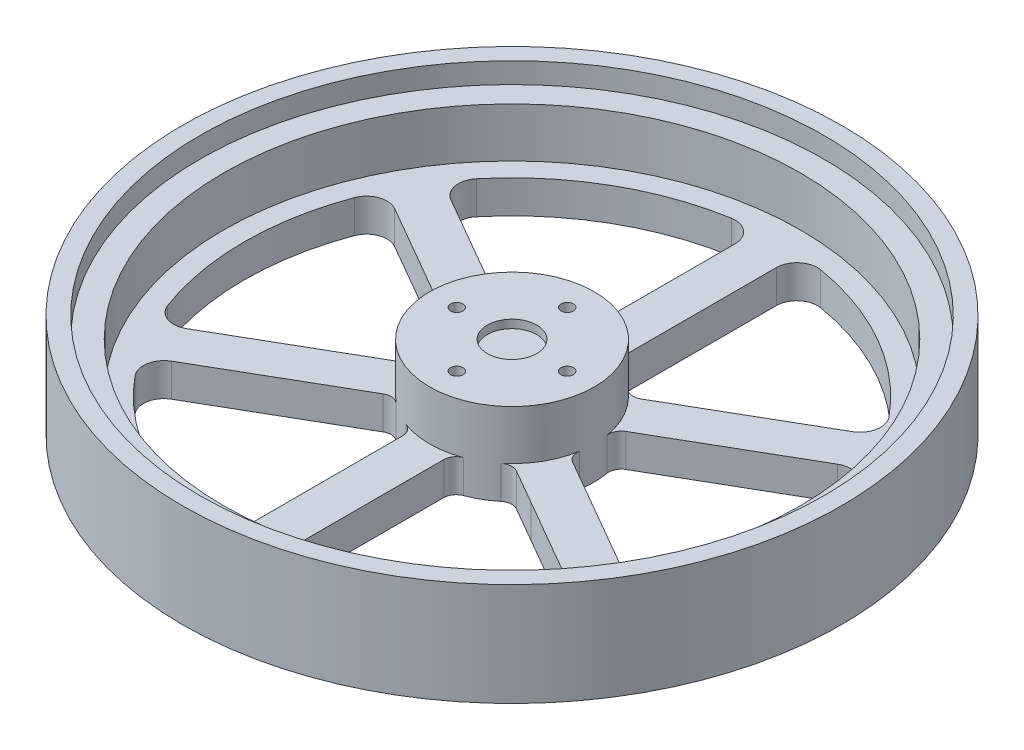
from build123d import *
from build123d.topology import SkipClean

# Parameters (mm, degrees)
SKETCH1_R                = 75
BOSS_EXTRUDE1_DEPTH      = 8
CUT_EXTRUDE11_DEPTH      = 107.367288205
CUT_EXTRUDE11_DEPTH_BACK = 107.367288205
FILLET1_R                = 5
CUT_EXTRUDE14_DEPTH      = 107.367288205
CUT_EXTRUDE14_DEPTH_BACK = 107.367288205
FILLET2_R                = 3
CUT_EXTRUDE15_DEPTH      = 107.367288353
CUT_EXTRUDE15_DEPTH_BACK = 107.367288353
SKETCH8_R                = 1.5
SKETCH18_R               = 20
BOSS_EXTRUDE4_DEPTH      = 12
CUT_EXTRUDE23_DEPTH      = 108.935165864
CUT_EXTRUDE23_DEPTH_BACK = 108.935165864
SKETCH19_R               = 1.5
SKETCH20_R               = 6
CUT_EXTRUDE25_DEPTH      = 2
SKETCH21_R               = 4
CUT_EXTRUDE27_DEPTH      = 10
SKETCH10_R               = 80
SKETCH10_R_2             = 75
BOSS_EXTRUDE5_DEPTH      = 25
SKETCH22_R               = 75
SKETCH22_R_2             = 70
BOSS_EXTRUDE7_DEPTH      = 12
SKETCH24_R               = 75.75
CUT_EXTRUDE28_DEPTH      = 5


with BuildPart() as part:
    # Sketch1 → Boss-Extrude1 (new body)
    with BuildSketch(Plane(origin=(0, 0, 0), x_dir=(1, 0, 0), z_dir=(0, 1, 0))):
        Circle(SKETCH1_R)
    extrude(amount=BOSS_EXTRUDE1_DEPTH)

    # Sketch6 → Cut-Extrude11 (cut, two sides: drawn at the far end of the back side and taken through both)
    with BuildSketch(Plane.XZ.offset(-CUT_EXTRUDE11_DEPTH_BACK)):
        with BuildLine():
            Line((23.541019662, -19.364916731), (5, -19.364916731))
            Line((5, -19.364916731), (5, -64.807406984))
            ThreePointArc((5, -64.807406984), (32.5, -56.291651246), (53.624860802, -36.733830511))
            Line((53.624860802, -36.733830511), (23.541019662, -19.364916731))
        make_face()
        with BuildLine():
            Line((5, 64.807406984), (5, 19.364916731))
            Line((5, 19.364916731), (23.541019662, 19.364916731))
            Line((23.541019662, 19.364916731), (53.624860802, 36.733830511))
            ThreePointArc((53.624860802, 36.733830511), (32.5, 56.291651246), (5, 64.807406984))
        make_face()
        with BuildLine():
            ThreePointArc((-53.624860802, -36.733830511), (-32.5, -56.291651246), (-5, -64.807406984))
            Line((-5, -64.807406984), (-5, -19.364916731))
            ThreePointArc((-5, -19.364916731), (-10, -17.320508076), (-14.270509831, -14.012585384))
            Line((-14.270509831, -14.012585384), (-53.624860802, -36.733830511))
        make_face()
        with BuildLine():
            ThreePointArc((-58.624860802, 28.073576473), (-65, 0), (-58.624860802, -28.073576473))
            Line((-58.624860802, -28.073576473), (-23.713203436, -7.917321695))
            ThreePointArc((-23.713203436, -7.917321695), (-25, 0), (-23.713203436, 7.917321695))
            Line((-23.713203436, 7.917321695), (-58.624860802, 28.073576473))
        make_face()
        with BuildLine():
            ThreePointArc((-5, 64.807406984), (-32.5, 56.291651246), (-53.624860802, 36.733830511))
            Line((-53.624860802, 36.733830511), (-14.270509831, 14.012585384))
            ThreePointArc((-14.270509831, 14.012585384), (-10, 17.320508076), (-5, 19.364916731))
            Line((-5, 19.364916731), (-5, 64.807406984))
        make_face()
        with BuildLine():
            ThreePointArc((58.624860802, -28.073576473), (65, 0), (58.624860802, 28.073576473))
            Line((58.624860802, 28.073576473), (41.229833462, 18.030552756))
            ThreePointArc((41.229833462, 18.030552756), (45, 0), (41.229833462, -18.030552756))
            Line((41.229833462, -18.030552756), (58.624860802, -28.073576473))
        make_face()
    extrude(amount=CUT_EXTRUDE11_DEPTH + CUT_EXTRUDE11_DEPTH_BACK, mode=Mode.SUBTRACT)

    # Fillet1
    fillet1_edges = [part.edges().sort_by_distance(p)[0] for p in [
        (53.624860802, 4, 36.733830511),
        (5, 4, 64.807406984),
        (-53.624860802, 4, 36.733830511),
        (-5, 4, 64.807406984),
        (-58.624860802, 4, 28.073576473),
        (-58.624860802, 4, -28.073576473),
        (-53.624860802, 4, -36.733830511),
        (-5, 4, -64.807406984),
        (5, 4, -64.807406984),
        (53.624860802, 4, -36.733830511),
        (58.624860802, 4, -28.073576473),
        (58.624860802, 4, 28.073576473),
        (41.229833462, 4, 18.030552756),
        (41.229833462, 4, -18.030552756),
        (5, 4, -19.364916731),
        (23.541019662, 4, -19.364916731),
        (-14.270509831, 4, -14.012585384),
        (-5, 4, -19.364916731),
        (-23.713203436, 4, 7.917321695),
        (-23.713203436, 4, -7.917321695),
        (-5, 4, 19.364916731),
        (-14.270509831, 4, 14.012585384),
        (5, 4, 19.364916731),
        (23.541019662, 4, 19.364916731),
    ]]
    fillet(fillet1_edges, radius=FILLET1_R)

    # Sketch7 → Cut-Extrude14 (cut, two sides: drawn at the far end of the back side and taken through both)
    with BuildSketch(Plane(origin=(0, 8, 0), x_dir=(1, 0, 0), z_dir=(0, 1, 0)).offset(-CUT_EXTRUDE14_DEPTH_BACK)):
        with BuildLine():
            Line((-46.123709543, -20.856033429), (-19.270509831, -5.352331347))
            ThreePointArc((-19.270509831, -5.352331347), (-19.999961472, -0.039257239), (-19.291373074, 5.276639549))
            Line((-19.291373074, 5.276639549), (-46.130652485, 20.840672105))
            ThreePointArc((-46.130652485, 20.840672105), (-50.619864099, -0.008428741), (-46.123709543, -20.856033429))
        make_face()
        with BuildLine():
            Line((5, -50.372320896), (5, -19.364916731))
            ThreePointArc((5, -19.364916731), (9.93287371, -17.35909041), (14.161591544, -14.1226529))
            Line((14.161591544, -14.1226529), (14.266776659, -14.017467786))
            Line((14.266776659, -14.017467786), (41.123709543, -29.517841507))
            Line((41.123709543, -29.517841507), (41.093462364, -29.558383978))
            ThreePointArc((41.093462364, -29.558383978), (25.287483281, -43.851042197), (5, -50.372320896))
        make_face()
        with BuildLine():
            Line((46.123709543, -20.856033429), (19.270509831, -5.352331347))
            ThreePointArc((19.270509831, -5.352331347), (20, 0), (19.270509831, 5.352331347))
            Line((19.270509831, 5.352331347), (46.123709543, 20.856033429))
            ThreePointArc((46.123709543, 20.856033429), (50.619864801, 0), (46.123709543, -20.856033429))
        make_face()
        with BuildLine():
            Line((-5, -50.372320896), (-5, -19.364916731))
            ThreePointArc((-5, -19.364916731), (-10, -17.320508076), (-14.270509831, -14.012585384))
            Line((-14.270509831, -14.012585384), (-41.123709543, -29.516287467))
            ThreePointArc((-41.123709543, -29.516287467), (-25.3099324, -43.838088853), (-5, -50.372320896))
        make_face()
        with BuildLine():
            Line((-5, 19.364916731), (-5, 50.372320896))
            ThreePointArc((-5, 50.372320896), (-25.3099324, 43.838088853), (-41.123709543, 29.516287467))
            Line((-41.123709543, 29.516287467), (-14.270509831, 14.012585384))
            ThreePointArc((-14.270509831, 14.012585384), (-10, 17.320508076), (-5, 19.364916731))
        make_face()
        with BuildLine():
            Line((5, 19.364916731), (5, 50.372320896))
            ThreePointArc((5, 50.372320896), (25.3099324, 43.838088853), (41.123709543, 29.516287467))
            Line((41.123709543, 29.516287467), (14.270509831, 14.012585384))
            ThreePointArc((14.270509831, 14.012585384), (10, 17.320508076), (5, 19.364916731))
        make_face()
    extrude(amount=CUT_EXTRUDE14_DEPTH + CUT_EXTRUDE14_DEPTH_BACK, mode=Mode.SUBTRACT)

    # Fillet2
    fillet2_edges = [part.edges().sort_by_distance(p)[0] for p in [
        (-19.291373074, 4, -5.276639549),
        (-19.270509831, 4, 5.352331347),
        (-5, 4, -19.364916731),
        (-14.270509831, 4, -14.012585384),
        (14.270509831, 4, -14.012585384),
        (5, 4, -19.364916731),
        (19.270509831, 4, -5.352331347),
        (19.270509831, 4, 5.352331347),
        (5, 4, 19.364916731),
        (14.266776659, 4, 14.017467786),
        (-5, 4, 19.364916731),
        (-14.270509831, 4, 14.012585384),
    ]]
    fillet(fillet2_edges, radius=FILLET2_R)

    # Sketch8 → Cut-Extrude15 (cut, two sides: drawn at the far end of the back side and taken through both)
    with BuildSketch(Plane(origin=(0, 8, 0), x_dir=(1, 0, 0), z_dir=(0, 1, 0)).offset(-CUT_EXTRUDE15_DEPTH_BACK)):
        with Locations((-13.4, 0)):
            Circle(SKETCH8_R)
        with Locations((0, 13.4)):
            Circle(SKETCH8_R)
        with Locations((13.4, 0)):
            Circle(SKETCH8_R)
        with Locations((0, -13.4)):
            Circle(SKETCH8_R)
    extrude(amount=CUT_EXTRUDE15_DEPTH + CUT_EXTRUDE15_DEPTH_BACK, mode=Mode.SUBTRACT)

    # Sketch18 → Boss-Extrude4 (add)
    with SkipClean():  # the faces are left unmerged after this step: merging them gives an invalid solid
        with BuildSketch(Plane(origin=(0, 8, 0), x_dir=(1, 0, 0), z_dir=(0, 1, 0))):
            Circle(SKETCH18_R)
        extrude(amount=BOSS_EXTRUDE4_DEPTH)

    # Sketch19 → Cut-Extrude23 (cut, two sides: drawn at the far end of the back side and taken through both)
    with SkipClean():  # the faces are left unmerged after this step: merging them gives an invalid solid
        with BuildSketch(Plane.XZ.offset(-CUT_EXTRUDE23_DEPTH_BACK)):
            with Locations((13.4, 0)):
                Circle(SKETCH19_R)
            with Locations((0, -13.4)):
                Circle(SKETCH19_R)
            with Locations((-13.4, 0)):
                Circle(SKETCH19_R)
            with Locations((0, 13.4)):
                Circle(SKETCH19_R)
        extrude(amount=CUT_EXTRUDE23_DEPTH + CUT_EXTRUDE23_DEPTH_BACK, mode=Mode.SUBTRACT)

    # Sketch20 → Cut-Extrude25 (cut)
    with SkipClean():  # the faces are left unmerged after this step: merging them gives an invalid solid
        with BuildSketch(Plane(origin=(0, 20, 0), x_dir=(1, 0, 0), z_dir=(0, 1, 0))):
            Circle(SKETCH20_R)
        extrude(amount=-CUT_EXTRUDE25_DEPTH, mode=Mode.SUBTRACT)

    # Sketch21 → Cut-Extrude27 (cut)
    with SkipClean():  # the faces are left unmerged after this step: merging them gives an invalid solid
        with BuildSketch(Plane.XZ):
            with Locations((13.4, 0)):
                Circle(SKETCH21_R)
            with Locations((0, -13.4)):
                Circle(SKETCH21_R)
            with Locations((0, 13.4)):
                Circle(SKETCH21_R)
            with Locations((-13.4, 0)):
                Circle(SKETCH21_R)
        extrude(amount=-CUT_EXTRUDE27_DEPTH, mode=Mode.SUBTRACT)

    # Sketch10 → Boss-Extrude5 (add)
    with SkipClean():  # the faces are left unmerged after this step: merging them gives an invalid solid
        with BuildSketch(Plane.XZ):
            Circle(SKETCH10_R)
            Circle(SKETCH10_R_2, mode=Mode.SUBTRACT)
        extrude(amount=-BOSS_EXTRUDE5_DEPTH)

    # Sketch22 → Boss-Extrude7 (add)
    with SkipClean():  # the faces are left unmerged after this step: merging them gives an invalid solid
        with BuildSketch(Plane(origin=(0, 8, 0), x_dir=(1, 0, 0), z_dir=(0, 1, 0))):
            Circle(SKETCH22_R)
            Circle(SKETCH22_R_2, mode=Mode.SUBTRACT)
        extrude(amount=BOSS_EXTRUDE7_DEPTH)

    # Sketch24 → Cut-Extrude28 (cut)
    with SkipClean():  # the faces are left unmerged after this step: merging them gives an invalid solid
        with BuildSketch(Plane(origin=(0, 25, 0), x_dir=(1, 0, 0), z_dir=(0, 1, 0))):
            Circle(SKETCH24_R)
        extrude(amount=-CUT_EXTRUDE28_DEPTH, mode=Mode.SUBTRACT)


solid = part.part
